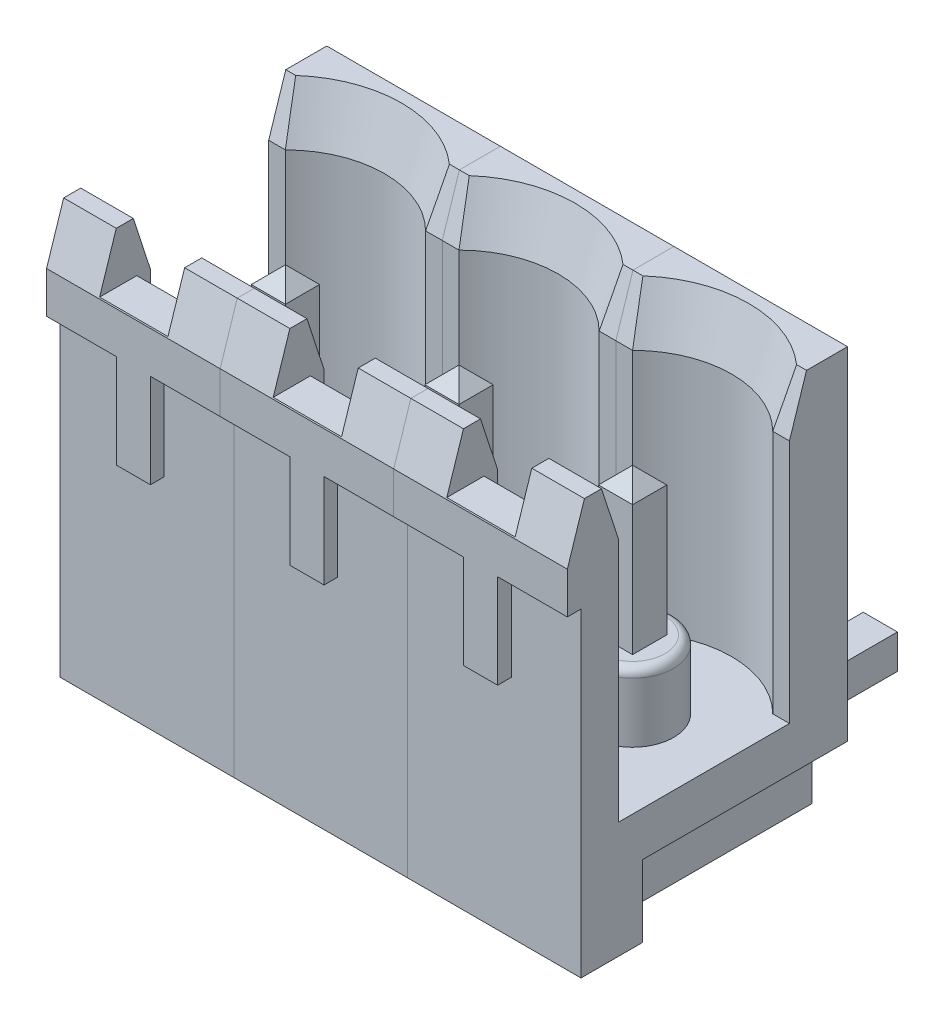
from build123d import *
from OCP.BRepFilletAPI import BRepFilletAPI_MakeChamfer

# Parameters (mm, degrees)
SKETCH_1_W             = 5.08
SKETCH_1_H             = 12.1
EXTRUDE_1_DEPTH        = 8.2
CUT_EXTRUDE_1_DEPTH    = 8.7
SKETCH_3_R             = 1.2
EXTRUDE_2_DEPTH        = 2
FILLET_1_R             = 0.25
CHAMFER_1_SIZE         = 0.5
CHAMFER_1_SIZE2        = 1.538841769
SKETCH_4_W             = 2
SKETCH_4_H             = 1.010953213
CUT_EXTRUDE_2_DEPTH    = 4.75
SKETCH_5_W             = 2
SKETCH_5_H             = 1.705458635
CUT_EXTRUDE_3_DEPTH    = 1.5
CHAMFER_2_SIZE         = 0.5
CHAMFER_2_SIZE2        = 1.538841769
SKETCH_6_W             = 5.08
SKETCH_6_H             = 6.6
CUT_EXTRUDE_4_DEPTH    = 0.4
SKETCH_7_W             = 2.04
SKETCH_7_H             = 2.75
CUT_EXTRUDE_5_DEPTH    = 0.4
EXTRUDE_1_2_DEPTH      = 0.5
EXTRUDE_1_2_DEPTH_BACK = 0.5
CHAMFER_3_SIZE         = 0.5
SKETCH_9_W             = 1
SKETCH_9_H             = 2.1
SKETCH_9_W_2           = 1.04
CUT_EXTRUDE_6_DEPTH    = 6
PATTERN_LINEAR_1_COUNT = 3
PATTERN_LINEAR_1_PITCH = 5.08
MOVE_BODY_1_ANGLE      = 180


with BuildPart() as part:
    # Эскиз1 → Extrude 1 (new body)
    with BuildSketch(Plane(origin=(0, 0, 0), x_dir=(1, 0, 0), z_dir=(0, 1, 0))):
        Rectangle(SKETCH_1_W, SKETCH_1_H)
    extrude(amount=EXTRUDE_1_DEPTH)

    # Эскиз2 → Вырез-Вытянуть1 (cut)
    with BuildSketch(Plane.XY.offset(6.05)):
        with BuildLine():
            Line((-2.54, 6.7), (2.54, 6.7))
            Line((2.54, 6.7), (2.54, 1.7))
            Line((2.54, 1.7), (2.05121915, 1.7))
            ThreePointArc((2.05121915, 1.7), (0, 0.85), (-2.05121915, 1.7))
            Line((-2.05121915, 1.7), (-2.54, 1.7))
            Line((-2.54, 1.7), (-2.54, 6.7))
        make_face()
    extrude(amount=-CUT_EXTRUDE_1_DEPTH, mode=Mode.SUBTRACT)

    # Эскиз3 → Бобышка-Вытянуть2 (add)
    with BuildSketch(Plane.XY.offset(-2.65)):
        with Locations((0, 3.75)):
            Circle(SKETCH_3_R)
    extrude(amount=EXTRUDE_2_DEPTH)

    # Скругление1
    fillet_1_edges = [part.edges().sort_by_distance(p)[0] for p in [
        (-1.2, 3.75, -0.65),
    ]]
    fillet(fillet_1_edges, radius=FILLET_1_R)

    # Фаска1: one chamfer whose edges measure the first distance from different faces: ONE call of the kernel's chamfer builder (chamfer() names one face for all edges)
    chamfer_1_edges_1 = [part.edges().sort_by_distance(p)[0] for p in [
        (0, 6.7, 6.05),
    ]]
    chamfer_1_side_1 = [part.faces().sort_by_distance(p)[0] for p in [
        (0, 7.45, 6.05),
    ]]
    chamfer_1_edges_2 = [part.edges().sort_by_distance(p)[0] for p in [
        (2.295609575, 1.7, 6.05),
        (-2.295609575, 1.7, 6.05),
        (0, 0.85, 6.05),
    ]]
    chamfer_1_side_2 = [part.faces().sort_by_distance(p)[0] for p in [
        (0, 0.655214235, 6.05),
    ]]
    chamfer_1 = BRepFilletAPI_MakeChamfer(part.part.solid().wrapped)
    for e in chamfer_1_edges_1:
        chamfer_1.Add(CHAMFER_1_SIZE, CHAMFER_1_SIZE2, e.wrapped, chamfer_1_side_1[0].wrapped)  # the first distance lies on this face
    for e in chamfer_1_edges_2:
        chamfer_1.Add(CHAMFER_1_SIZE, CHAMFER_1_SIZE2, e.wrapped, chamfer_1_side_2[0].wrapped)  # the first distance lies on this face
    add(Compound.cast(chamfer_1.Shape()), mode=Mode.REPLACE)

    # Эскиз4 → Вырез-Вытянуть2 (cut)
    with BuildSketch(Plane.XY.offset(6.05)):
        with Locations((0, 6.594523394)):
            Rectangle(SKETCH_4_W, SKETCH_4_H)
    extrude(amount=-CUT_EXTRUDE_2_DEPTH, mode=Mode.SUBTRACT)

    # Эскиз5 → Вырез-Вытянуть3 (cut)
    with BuildSketch(Plane.XY.offset(6.05)):
        with Locations((0, 7.552729318)):
            Rectangle(SKETCH_5_W, SKETCH_5_H)
    extrude(amount=-CUT_EXTRUDE_3_DEPTH, mode=Mode.SUBTRACT)

    # Фаска2
    chamfer_2_edges = [part.edges().sort_by_distance(p)[0] for p in [
        (-1.77, 8.2, 6.05),
    ]]
    chamfer_2_side = [part.faces().sort_by_distance(p)[0] for p in [
        (-1.77, 7.7, 6.05),
    ]]
    chamfer(chamfer_2_edges, length=CHAMFER_2_SIZE, length2=CHAMFER_2_SIZE2, reference=chamfer_2_side[0])

    # Эскиз6 → Вырез-Вытянуть4 (cut)
    with BuildSketch(Plane(origin=(0, 8.2, 0), x_dir=(1, 0, 0), z_dir=(0, 1, 0))):
        with Locations((0, 2.75)):
            Rectangle(SKETCH_6_W, SKETCH_6_H)
    extrude(amount=-CUT_EXTRUDE_4_DEPTH, mode=Mode.SUBTRACT)

    # Эскиз7 → Вырез-Вытянуть5 (cut)
    with BuildSketch(Plane(origin=(0, 8.2, 0), x_dir=(1, 0, 0), z_dir=(0, 1, 0))):
        with Locations((1.52, -1.925)):
            Rectangle(SKETCH_7_W, SKETCH_7_H)
        with Locations((-1.52, -1.925)):
            Rectangle(SKETCH_7_W, SKETCH_7_H)
    extrude(amount=-CUT_EXTRUDE_5_DEPTH, mode=Mode.SUBTRACT)

    # Эскиз9 → Вырез-Вытянуть6 (cut)
    with BuildSketch(Plane.XZ):
        with Locations((0, -5)):
            Rectangle(SKETCH_9_W, SKETCH_9_H)
        with Locations((-2.02, -5)):
            Rectangle(SKETCH_9_W_2, SKETCH_9_H)
        with Locations((2.02, -5)):
            Rectangle(SKETCH_9_W_2, SKETCH_9_H)
    extrude(amount=-CUT_EXTRUDE_6_DEPTH, mode=Mode.SUBTRACT)


with BuildPart() as body_2:
    # Эскиз8 → Extrude 1 2 (new, two sides: drawn at the far end of the back side and taken through both)
    with BuildSketch(Plane(origin=(0, 0, 0), x_dir=(0, 0, -1), z_dir=(1, 0, 0)).offset(-EXTRUDE_1_2_DEPTH_BACK)):
        with BuildLine():
            Line((-3.65, 3.25), (3.95, 3.25))
            Line((3.95, 3.25), (3.95, -4))
            Line((3.95, -4), (4.95, -4))
            Line((4.95, -4), (4.95, 3.25))
            ThreePointArc((4.95, 3.25), (4.657106781, 3.957106781), (3.95, 4.25))
            Line((3.95, 4.25), (-3.65, 4.25))
            Line((-3.65, 4.25), (-3.65, 3.25))
        make_face()
    extrude(amount=EXTRUDE_1_2_DEPTH + EXTRUDE_1_2_DEPTH_BACK)

    # Фаска3
    chamfer_3_edges = [body_2.edges().sort_by_distance(p)[0] for p in [
        (0, 3.25, 3.65),
        (0, 4.25, 3.65),
        (0, -4, -4.95),
        (0, -4, -3.95),
        (0.5, -4, -4.45),
        (0.5, 3.75, 3.65),
        (-0.5, 3.75, 3.65),
        (-0.5, -4, -4.45),
    ]]
    chamfer(chamfer_3_edges, length=CHAMFER_3_SIZE - 0.0001)  # a hair under: the kernel refuses the full size


with BuildPart() as pattern_linear_1_1:
    # Линейный массив1: pattern copy
    add(body_2.part.moved(Location(Vector(-1, 0, 0) * (1 * PATTERN_LINEAR_1_PITCH))))


with BuildPart() as pattern_linear_1_2:
    # Линейный массив1: pattern copy
    add(body_2.part.moved(Location(Vector(-1, 0, 0) * (2 * PATTERN_LINEAR_1_PITCH))))


with BuildPart() as pattern_linear_1_3:
    # Линейный массив1: pattern copy
    add(part.part.moved(Location(Vector(-1, 0, 0) * (1 * PATTERN_LINEAR_1_PITCH))))


with BuildPart() as pattern_linear_1_4:
    # Линейный массив1: pattern copy
    add(part.part.moved(Location(Vector(-1, 0, 0) * (2 * PATTERN_LINEAR_1_PITCH))))


with BuildPart() as body_2_1:
    # Move Body 1: moved
    add(body_2.part.rotate(Axis((0, 0, 0), (0, 0.7071067811865488, 0.7071067811865462)), MOVE_BODY_1_ANGLE))


with BuildPart() as part_1:
    # Move Body 1: moved
    add(part.part.rotate(Axis((0, 0, 0), (0, 0.7071067811865488, 0.7071067811865462)), MOVE_BODY_1_ANGLE))


with BuildPart() as pattern_linear_1_1_1:
    # Move Body 1: moved
    add(pattern_linear_1_1.part.rotate(Axis((0, 0, 0), (0, 0.7071067811865488, 0.7071067811865462)), MOVE_BODY_1_ANGLE))


with BuildPart() as pattern_linear_1_3_1:
    # Move Body 1: moved
    add(pattern_linear_1_3.part.rotate(Axis((0, 0, 0), (0, 0.7071067811865488, 0.7071067811865462)), MOVE_BODY_1_ANGLE))


with BuildPart() as pattern_linear_1_4_1:
    # Move Body 1: moved
    add(pattern_linear_1_4.part.rotate(Axis((0, 0, 0), (0, 0.7071067811865488, 0.7071067811865462)), MOVE_BODY_1_ANGLE))


with BuildPart() as pattern_linear_1_2_1:
    # Move Body 1: moved
    add(pattern_linear_1_2.part.rotate(Axis((0, 0, 0), (0, 0.7071067811865488, 0.7071067811865462)), MOVE_BODY_1_ANGLE))


with BuildPart() as pattern_linear_1_2_2:
    # Move Body 2: read off the stored shape, not the designer's step
    # Move Body 2: moved
    add(pattern_linear_1_2_1.part.moved(Location((0, 4.45, 0))))


with BuildPart() as pattern_linear_1_4_2:
    # Move Body 2 2: moved
    add(pattern_linear_1_4_1.part.moved(Location((0, 4.45, 0))))


with BuildPart() as pattern_linear_1_3_2:
    # Move Body 2 3: moved
    add(pattern_linear_1_3_1.part.moved(Location((0, 4.45, 0))))


with BuildPart() as pattern_linear_1_1_2:
    # Move Body 2 4: moved
    add(pattern_linear_1_1_1.part.moved(Location((0, 4.45, 0))))


with BuildPart() as part_2:
    # Move Body 2 5: moved
    add(part_1.part.moved(Location((0, 4.45, 0))))


with BuildPart() as body_2_2:
    # Move Body 2 6: moved
    add(body_2_1.part.moved(Location((0, 4.45, 0))))


solid = Compound([pattern_linear_1_2_2.part, pattern_linear_1_4_2.part, pattern_linear_1_3_2.part, pattern_linear_1_1_2.part, part_2.part, body_2_2.part])
